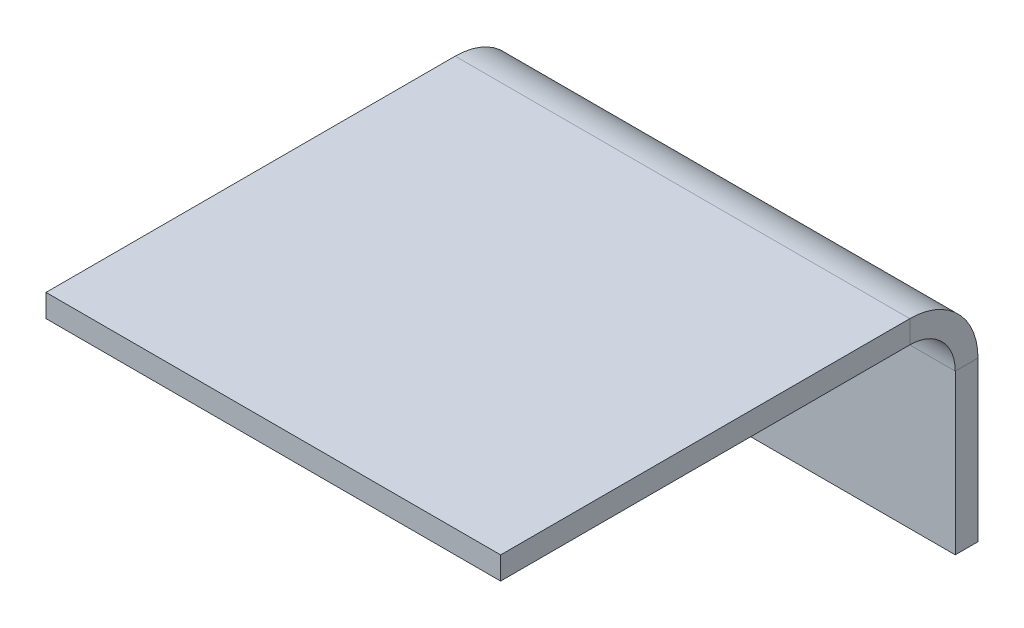
from build123d import *

# Parameters (mm, degrees)
SKETCH_1_W                 = 20
SKETCH_1_H                 = 10
BASEPLATE_DEPTH            = 1
EDGEFLANGE_STRIP_W         = 8
EDGEFLANGE_STRIP_H         = 1
EDGEFLANGE_STRIP_CUT_DEPTH = 20
EDGEFLANGE_DEPTH           = 20
EDGEFLANGE_FLAT_DEPTH      = 1


# Sheet-metal steps are written as plain solids
with BuildPart() as part:
    # Sketch 1 → BasePlate (new body)
    with BuildSketch(Plane.XY):
        with Locations((10, 5)):
            Rectangle(SKETCH_1_W, SKETCH_1_H)
    extrude(amount=-BASEPLATE_DEPTH)

    # EdgeFlange strip (across the edge) → EdgeFlange strip cut (cut)
    with BuildSketch(Plane(origin=(20, 10, 0), x_dir=(0, -1, 0), z_dir=(-1, 0, 0))):
        with Locations((-1, -0.5)):
            Rectangle(EDGEFLANGE_STRIP_W, EDGEFLANGE_STRIP_H)
    extrude(amount=EDGEFLANGE_STRIP_CUT_DEPTH, mode=Mode.SUBTRACT)

    # EdgeFlange bend section (across the edge) → EdgeFlange (add)
    with BuildSketch(Plane(origin=(20, 10, 0), x_dir=(0, -1, 0), z_dir=(-1, 0, 0))):
        with BuildLine():
            Line((0, 2), (1, 2))
            ThreePointArc((1, 2), (1.585786438, 0.585786438), (3, 0))
            Line((3, 0), (3, -1))
            ThreePointArc((3, -1), (0.878679656, -0.121320344), (0, 2))
        make_face()
    extrude(amount=EDGEFLANGE_DEPTH)

    # EdgeFlange profile (on flange) → EdgeFlange flat (add)
    with BuildSketch(Plane(origin=(0, 10, 0), x_dir=(-1, 0, 0), z_dir=(0, 1, 0))):
        Polygon((-20, 20), (-20, 2), (0, 2), (0, 20), (-2, 20), (-18, 20), align=None)
    extrude(amount=-EDGEFLANGE_FLAT_DEPTH)


solid = part.part
